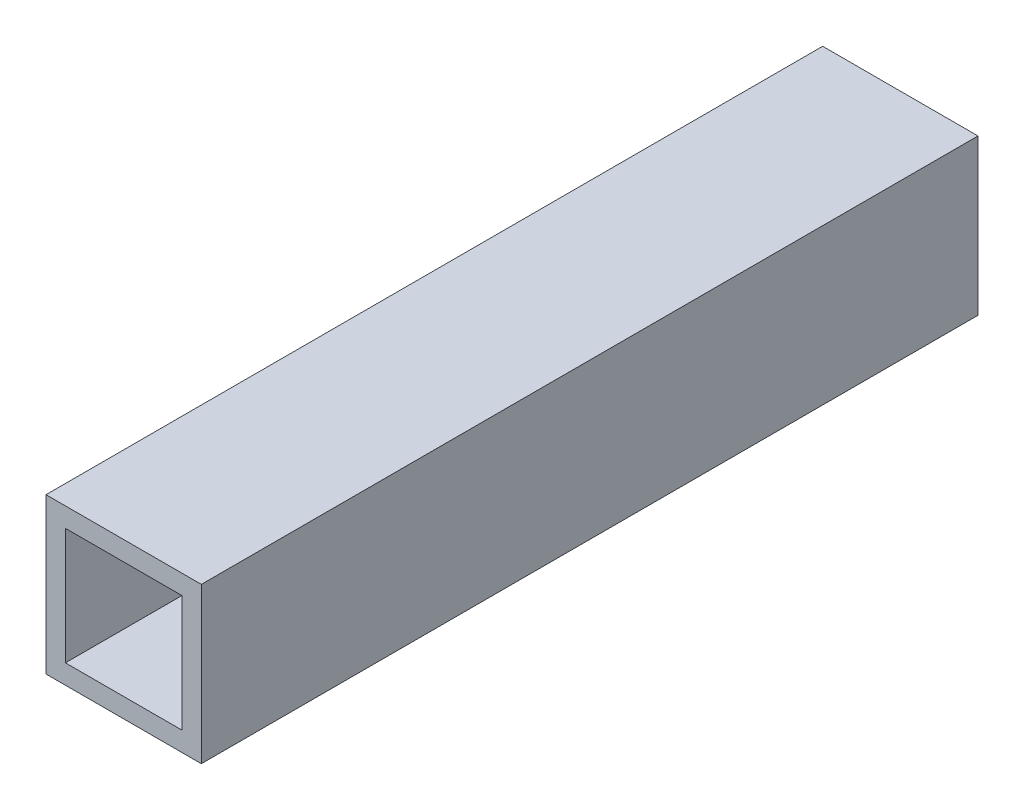
from build123d import *

# Parameters (mm, degrees)
SKETCH1_W           = 25.4
SKETCH1_H           = 25.4
BOSS_EXTRUDE1_DEPTH = 63.5
SHELL1_T            = -3.175


with BuildPart() as part:
    # Sketch1 → Boss-Extrude1 (new, symmetric)
    with BuildSketch(Plane.XY):
        Rectangle(SKETCH1_W, SKETCH1_H)
    extrude(amount=BOSS_EXTRUDE1_DEPTH, both=True)

    # Shell1
    shell1_openings = [part.faces().sort_by_distance(p)[0] for p in [
        (0, 0, -63.5),
        (0, 0, 63.5),
    ]]
    offset(amount=SHELL1_T, openings=shell1_openings, kind=Kind.INTERSECTION)


solid = part.part
